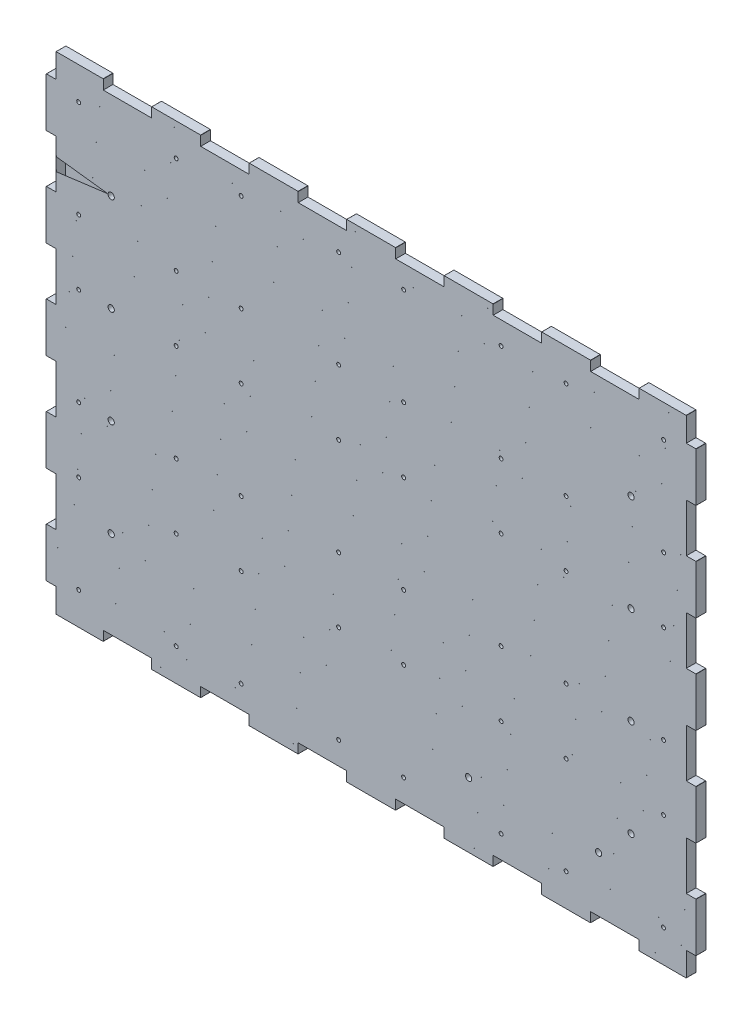
from build123d import *

# Parameters (mm, degrees)
BOSS_EXTRUDE1_DEPTH     = 5
SKETCH2_R               = 1
CUT_EXTRUDE3_DEPTH      = 209.354002841
SKETCH3_W               = 323
SKETCH3_H               = 0.001
SKETCH3_W_2             = 159
CUT_EXTRUDE_THIN2_DEPTH = 0.1
LPATTERN1_COUNT         = 15
LPATTERN1_PITCH         = 16.666666667
SKETCH4_R               = 1.6
CUT_EXTRUDE4_DEPTH      = 209.354002841
SKETCH5_W               = 0.001
SKETCH5_H               = 0.001
EXTRUDE_THIN2_DEPTH     = 0.1
MIRROR1_START           = -137.401
MIRROR1_DEPTH           = 0.001
MIRROR1_START_2         = -112.6
MIRROR1_2_DEPTH         = 0.001
MIRROR1_START_3         = -87.401
MIRROR1_3_DEPTH         = 0.001
MIRROR1_START_4         = -62.6
MIRROR1_4_DEPTH         = 0.001
MIRROR1_START_5         = -37.401
MIRROR1_5_DEPTH         = 0.001
MIRROR1_START_6         = -12.6
MIRROR1_6_DEPTH         = 0.001
MIRROR1_START_7         = 12.599
MIRROR1_7_DEPTH         = 0.001
MIRROR1_START_8         = 37.4
MIRROR1_8_DEPTH         = 0.001
MIRROR1_START_9         = 62.599
MIRROR1_9_DEPTH         = 0.001
MIRROR1_START_10        = 87.4
MIRROR1_10_DEPTH        = 0.001
MIRROR1_START_11        = 112.599
MIRROR1_11_DEPTH        = 0.001
MIRROR1_START_12        = 137.4
MIRROR1_12_DEPTH        = 0.001


# Read off the part's stored shape, not the designer's step: Mirror1
with BuildPart() as part:
    # Model → Boss-Extrude1 (new body)
    with BuildSketch(Plane.XY):
        Polygon((-137.44, -124.95), (-137.43, -124.94), (-137.42, -124.92), (-137.41, -124.91), (-137.4, -124.89), (-137.4, -119.97), (-112.6, -119.97), (-112.6, -124.89), (-112.58, -124.93), (-112.57, -124.94), (-112.55, -124.95), (-112.54, -124.96), (-112.52, -124.97), (-87.48, -124.97), (-87.44, -124.95), (-87.43, -124.94), (-87.42, -124.92), (-87.41, -124.91), (-87.4, -124.89), (-87.4, -119.97), (-62.6, -119.97), (-62.6, -124.89), (-62.58, -124.93), (-62.57, -124.94), (-62.55, -124.95), (-62.54, -124.96), (-62.52, -124.97), (-37.48, -124.97), (-37.44, -124.95), (-37.43, -124.94), (-37.42, -124.92), (-37.41, -124.91), (-37.4, -124.89), (-37.4, -119.97), (-12.6, -119.97), (-12.6, -124.89), (-12.58, -124.93), (-12.57, -124.94), (-12.55, -124.95), (-12.54, -124.96), (-12.52, -124.97), (12.52, -124.97), (12.56, -124.95), (12.57, -124.94), (12.58, -124.92), (12.59, -124.91), (12.6, -124.89), (12.6, -119.97), (37.4, -119.97), (37.4, -124.89), (37.42, -124.93), (37.43, -124.94), (37.45, -124.95), (37.46, -124.96), (37.48, -124.97), (62.52, -124.97), (62.56, -124.95), (62.57, -124.94), (62.58, -124.92), (62.59, -124.91), (62.6, -124.89), (62.6, -119.97), (87.4, -119.97), (87.4, -124.89), (87.42, -124.93), (87.43, -124.94), (87.45, -124.95), (87.46, -124.96), (87.48, -124.97), (112.52, -124.97), (112.56, -124.95), (112.57, -124.94), (112.58, -124.92), (112.59, -124.91), (112.6, -124.89), (112.6, -119.97), (137.4, -119.97), (137.4, -124.89), (137.42, -124.93), (137.43, -124.94), (137.45, -124.95), (137.46, -124.96), (137.48, -124.97), (161.56, -124.97), (161.6, -124.95), (161.61, -124.94), (161.62, -124.92), (161.63, -124.91), (161.64, -124.89), (161.64, -112.6), (166.56, -112.6), (166.6, -112.58), (166.61, -112.57), (166.62, -112.55), (166.63, -112.54), (166.64, -112.52), (166.64, -87.48), (166.62, -87.44), (166.61, -87.43), (166.59, -87.42), (166.58, -87.41), (166.56, -87.4), (161.64, -87.4), (161.64, -62.6), (166.56, -62.6), (166.6, -62.58), (166.61, -62.57), (166.62, -62.55), (166.63, -62.54), (166.64, -62.52), (166.64, -37.48), (166.62, -37.44), (166.61, -37.43), (166.59, -37.42), (166.58, -37.41), (166.56, -37.4), (161.64, -37.4), (161.64, -12.6), (166.56, -12.6), (166.6, -12.58), (166.61, -12.57), (166.62, -12.55), (166.63, -12.54), (166.64, -12.52), (166.64, 12.52), (166.62, 12.56), (166.61, 12.57), (166.59, 12.58), (166.58, 12.59), (166.56, 12.6), (161.64, 12.6), (161.64, 37.4), (166.56, 37.4), (166.6, 37.42), (166.61, 37.43), (166.62, 37.45), (166.63, 37.46), (166.64, 37.48), (166.64, 62.52), (166.62, 62.56), (166.61, 62.57), (166.59, 62.58), (166.58, 62.59), (166.56, 62.6), (161.64, 62.6), (161.64, 87.4), (166.56, 87.4), (166.6, 87.42), (166.61, 87.43), (166.62, 87.45), (166.63, 87.46), (166.64, 87.48), (166.64, 112.52), (166.62, 112.56), (166.61, 112.57), (166.59, 112.58), (166.58, 112.59), (166.56, 112.6), (161.64, 112.6), (161.64, 124.89), (161.62, 124.93), (161.61, 124.94), (161.59, 124.95), (161.58, 124.96), (161.56, 124.97), (137.48, 124.97), (137.44, 124.95), (137.43, 124.94), (137.42, 124.92), (137.41, 124.91), (137.4, 124.89), (137.4, 119.97), (112.6, 119.97), (112.6, 124.89), (112.58, 124.93), (112.57, 124.94), (112.55, 124.95), (112.54, 124.96), (112.52, 124.97), (87.48, 124.97), (87.44, 124.95), (87.43, 124.94), (87.42, 124.92), (87.41, 124.91), (87.4, 124.89), (87.4, 119.97), (62.6, 119.97), (62.6, 124.89), (62.58, 124.93), (62.57, 124.94), (62.55, 124.95), (62.54, 124.96), (62.52, 124.97), (37.48, 124.97), (37.44, 124.95), (37.43, 124.94), (37.42, 124.92), (37.41, 124.91), (37.4, 124.89), (37.4, 119.97), (12.6, 119.97), (12.6, 124.89), (12.58, 124.93), (12.57, 124.94), (12.55, 124.95), (12.54, 124.96), (12.52, 124.97), (-12.52, 124.97), (-12.56, 124.95), (-12.57, 124.94), (-12.58, 124.92), (-12.59, 124.91), (-12.6, 124.89), (-12.6, 119.97), (-37.4, 119.97), (-37.4, 124.89), (-37.42, 124.93), (-37.43, 124.94), (-37.45, 124.95), (-37.46, 124.96), (-37.48, 124.97), (-62.52, 124.97), (-62.56, 124.95), (-62.57, 124.94), (-62.58, 124.92), (-62.59, 124.91), (-62.6, 124.89), (-62.6, 119.97), (-87.4, 119.97), (-87.4, 124.89), (-87.42, 124.93), (-87.43, 124.94), (-87.45, 124.95), (-87.46, 124.96), (-87.48, 124.97), (-112.52, 124.97), (-112.56, 124.95), (-112.57, 124.94), (-112.58, 124.92), (-112.59, 124.91), (-112.6, 124.89), (-112.6, 119.97), (-137.4, 119.97), (-137.4, 124.89), (-137.42, 124.93), (-137.43, 124.94), (-137.45, 124.95), (-137.46, 124.96), (-137.48, 124.97), (-161.56, 124.97), (-161.6, 124.95), (-161.61, 124.94), (-161.62, 124.92), (-161.63, 124.91), (-161.64, 124.89), (-161.64, 112.6), (-166.56, 112.6), (-166.6, 112.58), (-166.61, 112.57), (-166.62, 112.55), (-166.63, 112.54), (-166.64, 112.52), (-166.64, 87.48), (-166.62, 87.44), (-166.61, 87.43), (-166.59, 87.42), (-166.58, 87.41), (-166.56, 87.4), (-161.64, 87.4), (-161.64, 62.6), (-166.56, 62.6), (-166.6, 62.58), (-166.61, 62.57), (-166.62, 62.55), (-166.63, 62.54), (-166.64, 62.52), (-166.64, 37.48), (-166.62, 37.44), (-166.61, 37.43), (-166.59, 37.42), (-166.58, 37.41), (-166.56, 37.4), (-161.64, 37.4), (-161.64, 12.6), (-166.56, 12.6), (-166.6, 12.58), (-166.61, 12.57), (-166.62, 12.55), (-166.63, 12.54), (-166.64, 12.52), (-166.64, -12.52), (-166.62, -12.56), (-166.61, -12.57), (-166.59, -12.58), (-166.58, -12.59), (-166.56, -12.6), (-161.64, -12.6), (-161.64, -37.4), (-166.56, -37.4), (-166.6, -37.42), (-166.61, -37.43), (-166.62, -37.45), (-166.63, -37.46), (-166.64, -37.48), (-166.64, -62.52), (-166.62, -62.56), (-166.61, -62.57), (-166.59, -62.58), (-166.58, -62.59), (-166.56, -62.6), (-161.64, -62.6), (-161.64, -87.4), (-166.56, -87.4), (-166.6, -87.42), (-166.61, -87.43), (-166.62, -87.45), (-166.63, -87.46), (-166.64, -87.48), (-166.64, -112.52), (-166.62, -112.56), (-166.61, -112.57), (-166.59, -112.58), (-166.58, -112.59), (-166.56, -112.6), (-161.64, -112.6), (-161.64, -124.89), (-161.62, -124.93), (-161.61, -124.94), (-161.59, -124.95), (-161.58, -124.96), (-161.56, -124.97), (-137.48, -124.97), align=None)
    extrude(amount=BOSS_EXTRUDE1_DEPTH)

    # Sketch2 → Cut-Extrude3 (cut, through all)
    with BuildSketch(Plane.XY.offset(5)):
        with Locations((-150, 108.333333333)):
            Circle(SKETCH2_R)
        with Locations((-100, 108.333333333)):
            Circle(SKETCH2_R)
        with Locations((-100, 58.333333333)):
            Circle(SKETCH2_R)
        with Locations((-150, 58.333333333)):
            Circle(SKETCH2_R)
        with Locations((-16.666666667, 58.333333333)):
            Circle(SKETCH2_R)
        with Locations((-66.666666667, 58.333333333)):
            Circle(SKETCH2_R)
        with Locations((-66.666666667, 108.333333333)):
            Circle(SKETCH2_R)
        with Locations((-16.666666667, 108.333333333)):
            Circle(SKETCH2_R)
        with Locations((66.666666667, 58.333333333)):
            Circle(SKETCH2_R)
        with Locations((16.666666667, 58.333333333)):
            Circle(SKETCH2_R)
        with Locations((16.666666667, 108.333333333)):
            Circle(SKETCH2_R)
        with Locations((66.666666667, 108.333333333)):
            Circle(SKETCH2_R)
        with Locations((150, 58.333333333)):
            Circle(SKETCH2_R)
        with Locations((100, 58.333333333)):
            Circle(SKETCH2_R)
        with Locations((100, 108.333333333)):
            Circle(SKETCH2_R)
        with Locations((150, 108.333333333)):
            Circle(SKETCH2_R)
        with Locations((-16.666666667, -25)):
            Circle(SKETCH2_R)
        with Locations((-66.666666667, -25)):
            Circle(SKETCH2_R)
        with Locations((-66.666666667, 25)):
            Circle(SKETCH2_R)
        with Locations((-16.666666667, 25)):
            Circle(SKETCH2_R)
        with Locations((66.666666667, -25)):
            Circle(SKETCH2_R)
        with Locations((16.666666667, -25)):
            Circle(SKETCH2_R)
        with Locations((16.666666667, 25)):
            Circle(SKETCH2_R)
        with Locations((66.666666667, 25)):
            Circle(SKETCH2_R)
        with Locations((150, -25)):
            Circle(SKETCH2_R)
        with Locations((100, -25)):
            Circle(SKETCH2_R)
        with Locations((100, 25)):
            Circle(SKETCH2_R)
        with Locations((150, 25)):
            Circle(SKETCH2_R)
        with Locations((-16.666666667, -108.333333333)):
            Circle(SKETCH2_R)
        with Locations((-66.666666667, -108.333333333)):
            Circle(SKETCH2_R)
        with Locations((-66.666666667, -58.333333333)):
            Circle(SKETCH2_R)
        with Locations((-16.666666667, -58.333333333)):
            Circle(SKETCH2_R)
        with Locations((66.666666667, -108.333333333)):
            Circle(SKETCH2_R)
        with Locations((16.666666667, -108.333333333)):
            Circle(SKETCH2_R)
        with Locations((16.666666667, -58.333333333)):
            Circle(SKETCH2_R)
        with Locations((66.666666667, -58.333333333)):
            Circle(SKETCH2_R)
        with Locations((150, -108.333333333)):
            Circle(SKETCH2_R)
        with Locations((100, -108.333333333)):
            Circle(SKETCH2_R)
        with Locations((100, -58.333333333)):
            Circle(SKETCH2_R)
        with Locations((150, -58.333333333)):
            Circle(SKETCH2_R)
        with Locations((-100, -25)):
            Circle(SKETCH2_R)
        with Locations((-150, -25)):
            Circle(SKETCH2_R)
        with Locations((-150, 25)):
            Circle(SKETCH2_R)
        with Locations((-100, 25)):
            Circle(SKETCH2_R)
        with Locations((-100, -108.333333333)):
            Circle(SKETCH2_R)
        with Locations((-150, -108.333333333)):
            Circle(SKETCH2_R)
        with Locations((-150, -58.333333333)):
            Circle(SKETCH2_R)
        with Locations((-100, -58.333333333)):
            Circle(SKETCH2_R)
    extrude(amount=-CUT_EXTRUDE3_DEPTH, mode=Mode.SUBTRACT)

    # Sketch3 → Cut-Extrude-Thin2 (cut)
    with BuildSketch(Plane.XY.offset(5)):
        Polygon((-161.5, 121.666166667), (-2.5, 121.66616676), (-2.5, 121.66716676), (-161.5, 121.667166667), align=None)
        with Locations((0, 111.666666667)):
            Rectangle(SKETCH3_W, SKETCH3_H)
        with Locations((82, 121.666666667)):
            Rectangle(SKETCH3_W_2, SKETCH3_H)
    cut_extrude_thin2 = extrude(amount=-CUT_EXTRUDE_THIN2_DEPTH, mode=Mode.SUBTRACT)

    # LPattern1: Cut-Extrude-Thin2 ×15
    with Locations(*[(0, -i * LPATTERN1_PITCH, 0) for i in range(1, LPATTERN1_COUNT)]):
        add(cut_extrude_thin2, mode=Mode.SUBTRACT)

    # Sketch4 → Cut-Extrude4 (cut, through all)
    with BuildSketch(Plane.XY.offset(5)):
        with Locations((-116.666666667, 91.666666667)):
            Circle(SKETCH4_R)
        with Locations((-133.333333333, 75)):
            Circle(SKETCH4_R)
        with Locations(Location((133.333333333, 75, 0), (0, 0, 180))):
            Circle(SKETCH4_R)
        with Locations(Location((116.666666667, 91.666666667, 0), (0, 0, 180))):
            Circle(SKETCH4_R)
        with Locations((133.333333333, -75)):
            Circle(SKETCH4_R)
        with Locations((116.666666667, -91.666666667)):
            Circle(SKETCH4_R)
        with Locations(Location((-116.666666667, -91.666666667, 0), (0, 0, 180))):
            Circle(SKETCH4_R)
        with Locations(Location((-133.333333333, -75, 0), (0, 0, 180))):
            Circle(SKETCH4_R)
        with Locations((-50, 91.666666667)):
            Circle(SKETCH4_R)
        with Locations((50, 91.666666667)):
            Circle(SKETCH4_R)
        with Locations(Location((50, -91.666666667, 0), (0, 0, 180))):
            Circle(SKETCH4_R)
        with Locations(Location((-50, -91.666666667, 0), (0, 0, 180))):
            Circle(SKETCH4_R)
        with Locations((-133.333333333, 25)):
            Circle(SKETCH4_R)
        with Locations((-133.333333333, -25)):
            Circle(SKETCH4_R)
        with Locations(Location((133.333333333, 25, 0), (0, 0, 180))):
            Circle(SKETCH4_R)
        with Locations(Location((133.333333333, -25, 0), (0, 0, 180))):
            Circle(SKETCH4_R)
    extrude(amount=-CUT_EXTRUDE4_DEPTH, mode=Mode.SUBTRACT)

    # Sketch5 → Extrude-Thin2 (add)
    with BuildSketch(Plane.XY.offset(5)):
        with Locations((-137.3995, -121.666666667)):
            Rectangle(SKETCH5_W, SKETCH5_H)
        with Locations((-87.3995, -121.666666667)):
            Rectangle(SKETCH5_W, SKETCH5_H)
        with Locations((-37.3995, -121.666666667)):
            Rectangle(SKETCH5_W, SKETCH5_H)
        with Locations((12.6005, -121.666666667)):
            Rectangle(SKETCH5_W, SKETCH5_H)
        with Locations((62.6005, -121.666666667)):
            Rectangle(SKETCH5_W, SKETCH5_H)
        with Locations((112.6005, -121.666666667)):
            Rectangle(SKETCH5_W, SKETCH5_H)
        with Locations((137.3995, -121.666666667)):
            Rectangle(SKETCH5_W, SKETCH5_H)
        with Locations((87.3995, -121.666666667)):
            Rectangle(SKETCH5_W, SKETCH5_H)
        with Locations((37.3995, -121.666666667)):
            Rectangle(SKETCH5_W, SKETCH5_H)
        with Locations((-12.6005, -121.666666667)):
            Rectangle(SKETCH5_W, SKETCH5_H)
        with Locations((-62.6005, -121.666666667)):
            Rectangle(SKETCH5_W, SKETCH5_H)
        with Locations((-112.6005, -121.666666667)):
            Rectangle(SKETCH5_W, SKETCH5_H)
    extrude(amount=-EXTRUDE_THIN2_DEPTH)


with BuildPart() as extrude_thin2_kept_piece:
    # of the separate pieces the step leaves, the one the design keeps (extrude_thin2_pieces_kept)
    add(part.part.solids().sort_by_distance((-137.44, -124.95, 0))[0])

    # Mirror1 outline → Mirror1 (add)
    with BuildSketch(Plane.YZ.offset(MIRROR1_START)):
        Polygon((121.667166698, 5), (121.666166702, 5), (121.666166697, 4.9), (121.66716671, 4.9), align=None)
    extrude(amount=MIRROR1_DEPTH)

    # Mirror1 2 outline → Mirror1 2 (add)
    with BuildSketch(Plane.YZ.offset(MIRROR1_START_2)):
        Polygon((121.667166698, 5), (121.666166702, 5), (121.666166697, 4.9), (121.66716671, 4.9), align=None)
    extrude(amount=MIRROR1_2_DEPTH)

    # Mirror1 3 outline → Mirror1 3 (add)
    with BuildSketch(Plane.YZ.offset(MIRROR1_START_3)):
        Polygon((121.667166698, 5), (121.666166702, 5), (121.666166697, 4.9), (121.66716671, 4.9), align=None)
    extrude(amount=MIRROR1_3_DEPTH)

    # Mirror1 4 outline → Mirror1 4 (add)
    with BuildSketch(Plane.YZ.offset(MIRROR1_START_4)):
        Polygon((121.667166698, 5), (121.666166702, 5), (121.666166697, 4.9), (121.66716671, 4.9), align=None)
    extrude(amount=MIRROR1_4_DEPTH)

    # Mirror1 5 outline → Mirror1 5 (add)
    with BuildSketch(Plane.YZ.offset(MIRROR1_START_5)):
        Polygon((121.667166698, 5), (121.666166702, 5), (121.666166697, 4.9), (121.66716671, 4.9), align=None)
    extrude(amount=MIRROR1_5_DEPTH)

    # Mirror1 6 outline → Mirror1 6 (add)
    with BuildSketch(Plane.YZ.offset(MIRROR1_START_6)):
        Polygon((121.667166698, 5), (121.666166702, 5), (121.666166697, 4.9), (121.66716671, 4.9), align=None)
    extrude(amount=MIRROR1_6_DEPTH)

    # Mirror1 7 outline → Mirror1 7 (add)
    with BuildSketch(Plane.YZ.offset(MIRROR1_START_7)):
        Polygon((121.667166698, 5), (121.666166702, 5), (121.666166697, 4.9), (121.66716671, 4.9), align=None)
    extrude(amount=MIRROR1_7_DEPTH)

    # Mirror1 8 outline → Mirror1 8 (add)
    with BuildSketch(Plane.YZ.offset(MIRROR1_START_8)):
        Polygon((121.667166698, 5), (121.666166702, 5), (121.666166697, 4.9), (121.66716671, 4.9), align=None)
    extrude(amount=MIRROR1_8_DEPTH)

    # Mirror1 9 outline → Mirror1 9 (add)
    with BuildSketch(Plane.YZ.offset(MIRROR1_START_9)):
        Polygon((121.667166698, 5), (121.666166702, 5), (121.666166697, 4.9), (121.66716671, 4.9), align=None)
    extrude(amount=MIRROR1_9_DEPTH)

    # Mirror1 10 outline → Mirror1 10 (add)
    with BuildSketch(Plane.YZ.offset(MIRROR1_START_10)):
        Polygon((121.667166698, 5), (121.666166702, 5), (121.666166697, 4.9), (121.66716671, 4.9), align=None)
    extrude(amount=MIRROR1_10_DEPTH)

    # Mirror1 11 outline → Mirror1 11 (add)
    with BuildSketch(Plane.YZ.offset(MIRROR1_START_11)):
        Polygon((121.667166698, 5), (121.666166702, 5), (121.666166697, 4.9), (121.66716671, 4.9), align=None)
    extrude(amount=MIRROR1_11_DEPTH)

    # Mirror1 12 outline → Mirror1 12 (add)
    with BuildSketch(Plane.YZ.offset(MIRROR1_START_12)):
        Polygon((121.667166698, 5), (121.666166702, 5), (121.666166697, 4.9), (121.66716671, 4.9), align=None)
    extrude(amount=MIRROR1_12_DEPTH)


solid = extrude_thin2_kept_piece.part
